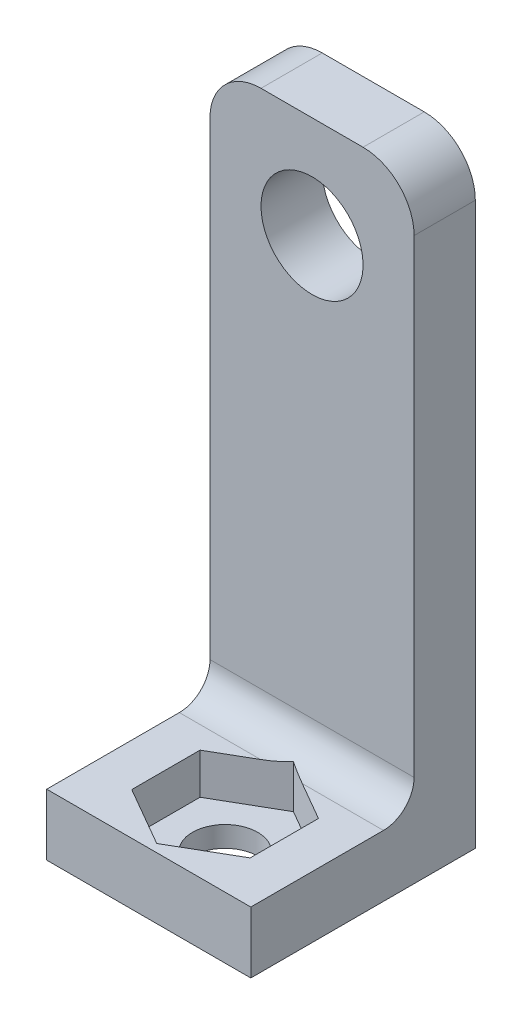
from build123d import *

# Parameters (mm, degrees)
SKETCH_1_W          = 10
SKETCH_1_H          = 30
EXTRUDE_1_DEPTH     = 3
SKETCH_2_R          = 2.5
CUT_EXTRUDE_1_DEPTH = 3
FILLET_2_R          = 2.5
FILLET_3_R          = 2.5
SKETCH_3_W          = 10
SKETCH_3_H          = 3.011531622
EXTRUDE_2_DEPTH     = 8
SKETCH_4_R          = 1.6
CUT_EXTRUDE_2_DEPTH = 7
CUT_EXTRUDE_3_DEPTH = 2
FILLET_4_R          = 1.5


with BuildPart() as part:
    # Эскиз1 → Бобышка-Вытянуть1 (new body)
    with BuildSketch(Plane.XY):
        Rectangle(SKETCH_1_W, SKETCH_1_H)
    extrude(amount=EXTRUDE_1_DEPTH)

    # Эскиз2 → Вырез-Вытянуть1 (cut)
    with BuildSketch(Plane(origin=(0, 0, 0), x_dir=(-1, 0, 0), z_dir=(0, 0, -1))):
        with Locations((0, 10)):
            Circle(SKETCH_2_R)
    extrude(amount=-CUT_EXTRUDE_1_DEPTH, mode=Mode.SUBTRACT)

    # Скругление2
    fillet_2_edges = [part.edges().sort_by_distance(p)[0] for p in [
        (5, 15, 1.5),
    ]]
    fillet(fillet_2_edges, radius=FILLET_2_R)

    # Скругление3
    fillet_3_edges = [part.edges().sort_by_distance(p)[0] for p in [
        (-5, 15, 1.5),
    ]]
    fillet(fillet_3_edges, radius=FILLET_3_R)

    # Эскиз3 → Бобышка-Вытянуть2 (add)
    with BuildSketch(Plane.XY.offset(3)):
        with Locations((0, -13.494234189)):
            Rectangle(SKETCH_3_W, SKETCH_3_H)
    extrude(amount=EXTRUDE_2_DEPTH)

    # Эскиз4 → Вырез-Вытянуть2 (cut)
    with BuildSketch(Plane(origin=(0, -11.988468378, 0), x_dir=(1, 0, 0), z_dir=(0, 1, 0))):
        with Locations(Location((0, -7.259187187, 0), (0, 0, 270))):
            Circle(SKETCH_4_R)
    extrude(amount=-CUT_EXTRUDE_2_DEPTH, mode=Mode.SUBTRACT)

    # Эскиз6 → Вырез-Вытянуть3 (cut)
    with BuildSketch(Plane(origin=(0, -11.988468378, 0), x_dir=(1, 0, 0), z_dir=(0, 1, 0))):
        Polygon((2.9, -8.933502968), (2.9, -5.584871406), (0, -3.910555626), (-2.9, -5.584871406), (-2.9, -8.933502968), (0, -10.607818748), align=None)
    extrude(amount=-CUT_EXTRUDE_3_DEPTH, mode=Mode.SUBTRACT)

    # Скругление4
    # the kernel refuses this fillet: 1.5 mm, written as the material it adds along each edge
    with BuildSketch(Plane(origin=(5, -11.988468378, 3), x_dir=(0, 1, 0), z_dir=(-1, 0, 0))) as fillet_4_piece_1_section:
        with BuildLine():
            CenterArc((FILLET_4_R, -FILLET_4_R), FILLET_4_R, 90, 90)
            Line((0, -FILLET_4_R), (0, 0))
            Line((0, 0), (FILLET_4_R, 0))
        make_face()
    fillet_4_piece_1 = extrude(amount=10, mode=Mode.PRIVATE)
    fillet_4_piece_1 = split(fillet_4_piece_1, bisect_by=Plane(origin=(2.478209897, -11.671443833, 2.479760474), z_dir=(0.49999999999999983, 0, 0.8660254037844388)), keep=Keep.TOP, mode=Mode.PRIVATE)
    fillet_4_piece_1 = split(fillet_4_piece_1, bisect_by=Plane(origin=(2.013101716, -11.671443833, 5.072820443), z_dir=(0.49999999999999994, 0, -0.8660254037844387)), keep=Keep.TOP, mode=Mode.PRIVATE)
    add(fillet_4_piece_1)
    with BuildSketch(Plane(origin=(5, -11.988468378, 3), x_dir=(0, 1, 0), z_dir=(-1, 0, 0))) as fillet_4_piece_2_section:
        with BuildLine():
            CenterArc((FILLET_4_R, -FILLET_4_R), FILLET_4_R, 90, 90)
            Line((0, -FILLET_4_R), (0, 0))
            Line((0, 0), (FILLET_4_R, 0))
        make_face()
    fillet_4_piece_2 = extrude(amount=10, mode=Mode.PRIVATE)
    fillet_4_piece_2 = split(fillet_4_piece_2, bisect_by=Plane(origin=(0.3145023, -11.552147507, 3.728977638), z_dir=(-0.49999999999999983, 0, -0.8660254037844388)), keep=Keep.TOP, mode=Mode.PRIVATE)
    fillet_4_piece_2 = split(fillet_4_piece_2, bisect_by=Plane(origin=(-0.3145023, -11.552147507, 3.728977638), z_dir=(0.49999999999999994, 0, -0.8660254037844387)), keep=Keep.TOP, mode=Mode.PRIVATE)
    add(fillet_4_piece_2)
    with BuildSketch(Plane(origin=(5, -11.988468378, 3), x_dir=(0, 1, 0), z_dir=(-1, 0, 0))) as fillet_4_piece_3_section:
        with BuildLine():
            CenterArc((FILLET_4_R, -FILLET_4_R), FILLET_4_R, 90, 90)
            Line((0, -FILLET_4_R), (0, 0))
            Line((0, 0), (FILLET_4_R, 0))
        make_face()
    fillet_4_piece_3 = extrude(amount=10, mode=Mode.PRIVATE)
    fillet_4_piece_3 = split(fillet_4_piece_3, bisect_by=Plane(origin=(-2.013101716, -11.671443833, 5.072820443), z_dir=(-0.49999999999999983, 0, -0.8660254037844388)), keep=Keep.TOP, mode=Mode.PRIVATE)
    fillet_4_piece_3 = split(fillet_4_piece_3, bisect_by=Plane(origin=(-2.478209897, -11.671443833, 2.479760474), z_dir=(-0.49999999999999994, 0, 0.8660254037844387)), keep=Keep.TOP, mode=Mode.PRIVATE)
    add(fillet_4_piece_3)


solid = part.part
